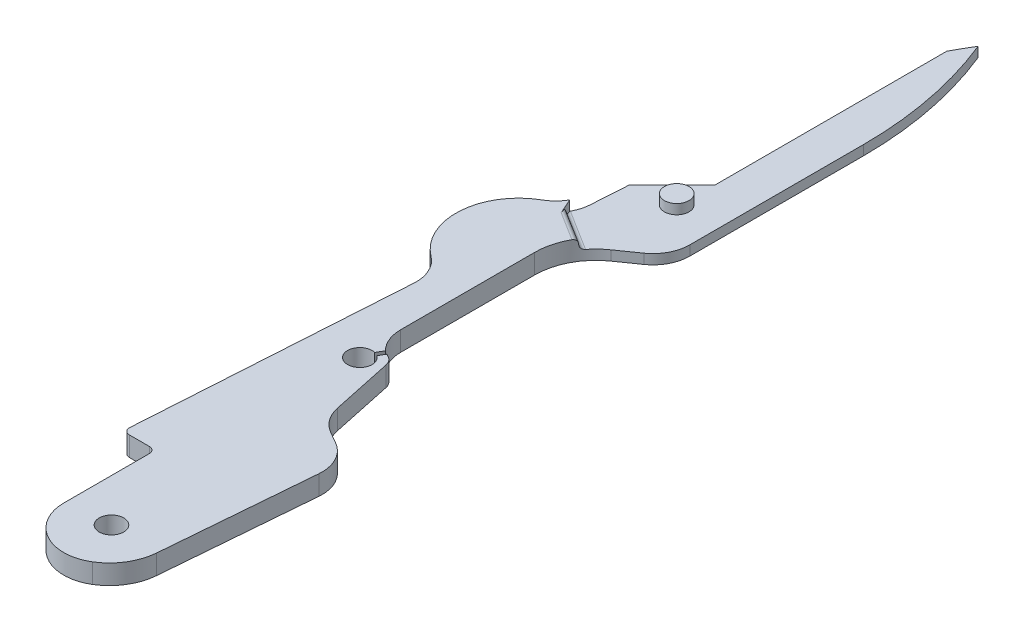
from build123d import *

# Parameters (mm, degrees)
BOSS_EXTRUDE1_DEPTH     = 0.8
FILLET1_R               = 4.2
SKETCH2_R               = 1
CUT_EXTRUDE1_DEPTH      = 75.905340264
CUT_EXTRUDE2_DEPTH      = 75.905340264
CUT_EXTRUDE_THIN1_DEPTH = 75.905340264
FILLET2_R               = 3
CUT_EXTRUDE4_DEPTH      = 0.8
FILLET3_R               = 5
FILLET4_R               = 0.4
FILLET5_R               = 3
FILLET6_R               = 1
SKETCH6_R               = 1
BOSS_EXTRUDE2_DEPTH     = 0.8
SKETCH7_W               = 3
SKETCH7_H               = 11.1
CUT_EXTRUDE5_DEPTH      = 75.882809828
FILLET7_R               = 0.5
FILLET8_R               = 0.5
FILLET10_R              = 3.5
CUT_EXTRUDE6_DEPTH      = 0.5
FILLET11_R              = 2.4


# Some blends are built 0.0001 mm under size
with BuildPart() as part:
    # Sketch1 → Boss-Extrude1 (new, symmetric)
    with BuildSketch(Plane(origin=(0, 0, 0), x_dir=(1, 0, 0), z_dir=(0, 1, 0))):
        with BuildLine():
            Line((0, 0), (0, 6))
            Line((0, 6), (1.865312064, 35.32161706))
            ThreePointArc((1.865312064, 35.32161706), (-1.478238126, 40.437157563), (2.486591749, 45.087771133))
            Line((2.486591749, 45.087771133), (3.611473385, 62.770253978))
            ThreePointArc((3.611473385, 62.770253978), (4.720909281, 68.611088902), (7.232052008, 74))
            ThreePointArc((7.232052008, 74), (8.927699757, 68.307599169), (9.5, 62.395651864))
            Line((9.5, 62.395651864), (9.5, 46.645651864))
            Line((9.5, 46.645651864), (4.5, 43.144614173))
            Line((4.5, 43.144614173), (4.5, 27.994614173))
            Line((4.5, 27.994614173), (6.3, 26.955383689))
            Line((6.3, 26.955383689), (7.743698597, 20.163315799))
            Line((7.743698597, 20.163315799), (11.5, 17.994614173))
            Line((11.5, 17.994614173), (10, 0))
            Line((10, 0), (0, 0))
        make_face()
    extrude(amount=BOSS_EXTRUDE1_DEPTH, both=True)

    # Fillet1
    fillet1_edges = [part.edges().sort_by_distance(p)[0] for p in [
        (10, 0, 0),
    ]]
    fillet(fillet1_edges, radius=FILLET1_R)

    # Sketch2 → Cut-Extrude1 (cut, through all)
    with BuildSketch(Plane(origin=(0, 0.8, 0), x_dir=(1, 0, 0), z_dir=(0, 1, 0))):
        with Locations(Location((6.5, 4, 0), (0, 0, 270))):
            Circle(SKETCH2_R)
    extrude(amount=-CUT_EXTRUDE1_DEPTH, mode=Mode.SUBTRACT)

    # Sketch3 → Cut-Extrude2 (cut, through all)
    with BuildSketch(Plane(origin=(0, 0.8, 0), x_dir=(1, 0, 0), z_dir=(0, 1, 0))):
        with BuildLine():
            Line((5.640057539, 27.969251754), (5.047431638, 26.942793585))
            ThreePointArc((5.047431638, 26.942793585), (4.386066515, 25.063581102), (5.367538565, 26.797235046))
            Line((5.367538565, 26.797235046), (5.94316643, 27.794251754))
            Line((5.94316643, 27.794251754), (5.640057539, 27.969251754))
        make_face()
    extrude(amount=-CUT_EXTRUDE2_DEPTH, mode=Mode.SUBTRACT)

    # Sketch4 → Cut-Extrude-Thin1 (cut, through all)
    with BuildSketch(Plane(origin=(0, 0.8, 0), x_dir=(1, 0, 0), z_dir=(0, 1, 0))):
        Polygon((6.299086102, 72.375061168), (6.299086102, 53.5), (2.799086102, 50), (-4.271981709, 57.071067812), (-3.700913898, 57.642135624), (-3.700913898, 72.375061168), align=None)
    extrude(amount=-CUT_EXTRUDE_THIN1_DEPTH, mode=Mode.SUBTRACT)

    # Fillet2
    fillet2_edges = [part.edges().sort_by_distance(p)[0] for p in [
        (1.865312064, 0, -35.32161706),
        (2.486591749, 0, -45.087771133),
        (9.5, 0, -46.645651864),
    ]]
    fillet(fillet2_edges, radius=FILLET2_R)

    # Sketch5 → Cut-Extrude4 (cut)
    with BuildSketch(Plane(origin=(0, 0.8, 0), x_dir=(1, 0, 0), z_dir=(0, 1, 0))):
        Polygon((2.486591749, 45.087771133), (13.455116217, 38.22222401), (13.455116217, 80.886155846), (2.486591749, 80.886155846), (1.62289593, 47.027246142), align=None)
    extrude(amount=-CUT_EXTRUDE4_DEPTH, mode=Mode.SUBTRACT)

    # Fillet3
    fillet3_edges = [part.edges().sort_by_distance(p)[0] for p in [
        (4.5, 0, -43.144614173),
    ]]
    fillet(fillet3_edges, radius=FILLET3_R)

    # Fillet4
    fillet4_edges = [part.edges().sort_by_distance(p)[0] for p in [
        (3.91002639, 0, -44.196798274),
        (3.91002639, 0.8, -44.196798274),
    ]]
    fillet(fillet4_edges, radius=FILLET4_R - 0.0001)  # a hair under: the kernel refuses the full size

    # Fillet5
    # the kernel refuses this fillet: 3 mm, written as the material it adds along each edge
    with BuildSketch(Plane(origin=(4.5, 0.8, -27.994614173), x_dir=(0.8660254037844444, 0, 0.49999999999999023), z_dir=(0, -1, 0))) as fillet5_piece_1:
        with BuildLine():
            CenterArc((1.793781136, -2.893079935), FILLET5_R, 105.342812505, 44.657187495)
            Line((-0.804295075, -1.393079935), (0, 0))
            Line((0, 0), (1, 0))
        make_face()
    extrude(amount=1.6)
    with BuildSketch(Plane(origin=(7.743698597, 0.8, -20.163315799), x_dir=(0.8660254037844403, 0, 0.49999999999999734), z_dir=(0, -1, 0))) as fillet5_piece_2:
        with BuildLine():
            CenterArc((FILLET5_R * 0.445228685309, -FILLET5_R), FILLET5_R, 90, 48)
            Line((-FILLET5_R * 0.297916140169, -FILLET5_R * 0.330869393641), (0, 0))
            Line((0, 0), (FILLET5_R * 0.445228685309, 0))
        make_face()
    extrude(amount=1.6)
    # the kernel refuses this fillet: 3 mm, written as the material it takes off along each edge
    with BuildSketch(Plane(origin=(11.5, -5.55643762, -17.994614173), x_dir=(-0.86602540378444, 0, -0.49999999999999756), z_dir=(0, 1, 0))) as fillet5_2_piece_1:
        with BuildLine():
            CenterArc((FILLET5_R * 0.634191682642, FILLET5_R), FILLET5_R, 205.234939105, 64.765060895)
            Line((-FILLET5_R * 0.270375560362, FILLET5_R * 0.573669021903), (0, 0))
            Line((0, 0), (FILLET5_R * 0.634191682642, 0))
        make_face()
    extrude(amount=11.11287524, mode=Mode.SUBTRACT)

    # Fillet6
    fillet6_edges = [part.edges().sort_by_distance(p)[0] for p in [
        (6.3, 0, -26.955383689),
    ]]
    fillet(fillet6_edges, radius=FILLET6_R)

    # Sketch6 → Boss-Extrude2 (add)
    with BuildSketch(Plane(origin=(0, 0, 0), x_dir=(1, 0, 0), z_dir=(0, 1, 0))):
        with Locations(Location((6.14, 50.5, 0), (0, 0, 90))):
            Circle(SKETCH6_R)
    extrude(amount=BOSS_EXTRUDE2_DEPTH)

    # Sketch7 → Cut-Extrude5 (cut, through all)
    with BuildSketch(Plane(origin=(0, 0.8, 0), x_dir=(1, 0, 0), z_dir=(0, 1, 0))):
        with Locations((1.5, 5.55)):
            Rectangle(SKETCH7_W, SKETCH7_H)
    extrude(amount=-CUT_EXTRUDE5_DEPTH, mode=Mode.SUBTRACT)

    # Fillet7
    fillet7_edges = [part.edges().sort_by_distance(p)[0] for p in [
        (0.324439526, 0, -11.1),
    ]]
    fillet(fillet7_edges, radius=FILLET7_R)

    # Fillet8
    fillet8_edges = [part.edges().sort_by_distance(p)[0] for p in [
        (3, 0, -11.1),
    ]]
    fillet(fillet8_edges, radius=FILLET8_R)

    # Fillet10
    fillet10_edges = [part.edges().sort_by_distance(p)[0] for p in [
        (3, 0, 0),
    ]]
    fillet(fillet10_edges, radius=FILLET10_R)

    # Sketch8 → Cut-Extrude6 (cut)
    with BuildSketch(Plane.XZ.offset(0.8)):
        with BuildLine():
            Line((0, -42.705581243), (-0.472751816, -38.234175203))
            ThreePointArc((-0.472751816, -38.234175203), (1.308763911, -40.306514027), (0, -42.705581243))
        make_face()
    extrude(amount=-CUT_EXTRUDE6_DEPTH, mode=Mode.SUBTRACT)

    # Fillet11
    # the kernel refuses this fillet: 2.4 mm, written as the material it adds along each edge
    with BuildSketch(Plane(origin=(-1.081254443, -0.3, -40.559205352), x_dir=(-0.9553191525831795, 0, 0.2955762451682408), z_dir=(-0.2955762451682408, 0, -0.9553191525831795))) as fillet11_piece_1_section:
        with BuildLine():
            CenterArc((0.937051647, -2.4), FILLET11_R, 52.341537994, 37.658462006)
            Line((0.937051647, 0), (0.937051647, 0.048))
            Line((0.937051647, 0.048), (2.403339477, 0.048))
            Line((2.403339477, 0.048), (2.451339477, 0))
            ThreePointArc((2.451339477, 0), (2.451339477, -0.25), (2.432665233, -0.462))
            Line((2.432665233, -0.462), (2.403339477, -0.5))
        make_face()
    fillet11_piece_1 = revolve(axis=Axis((-1.081254443, -0.3, -40.559205352), (0, 1, 0)), revolution_arc=313.54514328, mode=Mode.PRIVATE)
    fillet11_piece_1 = split(fillet11_piece_1, bisect_by=Plane(origin=(-0.236375908, -0.3, -40.469878223), z_dir=(0.9944572448546122, 0, 0.1051417526778682)), keep=Keep.TOP, mode=Mode.PRIVATE)
    add(fillet11_piece_1)


solid = part.part
